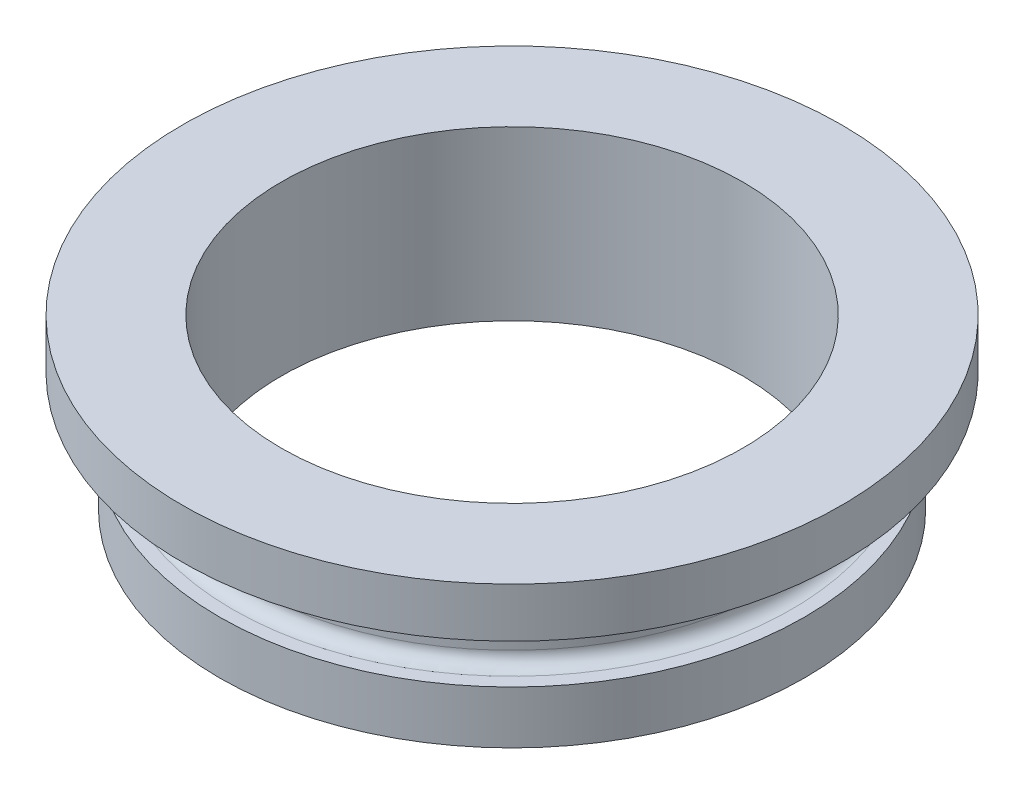
from build123d import *

# Parameters (mm, degrees)
SKETCH2_R           = 56.35625
BOSS_EXTRUDE1_DEPTH = 22.86
SKETCH3_R           = 63.5
BOSS_EXTRUDE2_DEPTH = 9.525
SKETCH4_R           = 44.45
CUT_EXTRUDE1_DEPTH  = 96.463543958
SKETCH9_W           = 5.08
SKETCH9_H           = 12.7
FILLET1_R           = 2.54


with BuildPart() as part:
    # Sketch2 → Boss-Extrude1 (new body)
    with BuildSketch(Plane(origin=(0, 0, 0), x_dir=(1, 0, 0), z_dir=(0, 1, 0))):
        Circle(SKETCH2_R)
    extrude(amount=BOSS_EXTRUDE1_DEPTH)

    # Sketch3 → Boss-Extrude2 (add)
    with BuildSketch(Plane(origin=(0, 22.86, 0), x_dir=(1, 0, 0), z_dir=(0, 1, 0))):
        Circle(SKETCH3_R)
    extrude(amount=BOSS_EXTRUDE2_DEPTH)

    # Sketch4 → Cut-Extrude1 (cut, through all)
    with BuildSketch(Plane.XZ):
        Circle(SKETCH4_R)
    extrude(amount=-CUT_EXTRUDE1_DEPTH, mode=Mode.SUBTRACT)

    # Sketch9 → Cut-Revolve1 (revolve, cut)
    with BuildSketch(Plane(origin=(0, 0, 0), x_dir=(0, 0, -1), z_dir=(1, 0, 0))):
        with Locations((53.81625, 16.51)):
            Rectangle(SKETCH9_W, SKETCH9_H)
    revolve(axis=Axis((0, 0, 0), (0, 1, 0)), mode=Mode.SUBTRACT)

    # Fillet1
    fillet1_edges = [part.edges().sort_by_distance(p)[0] for p in [
        (0, 10.16, 51.27625),
        (0, 22.86, 51.27625),
    ]]
    fillet(fillet1_edges, radius=FILLET1_R)


solid = part.part
